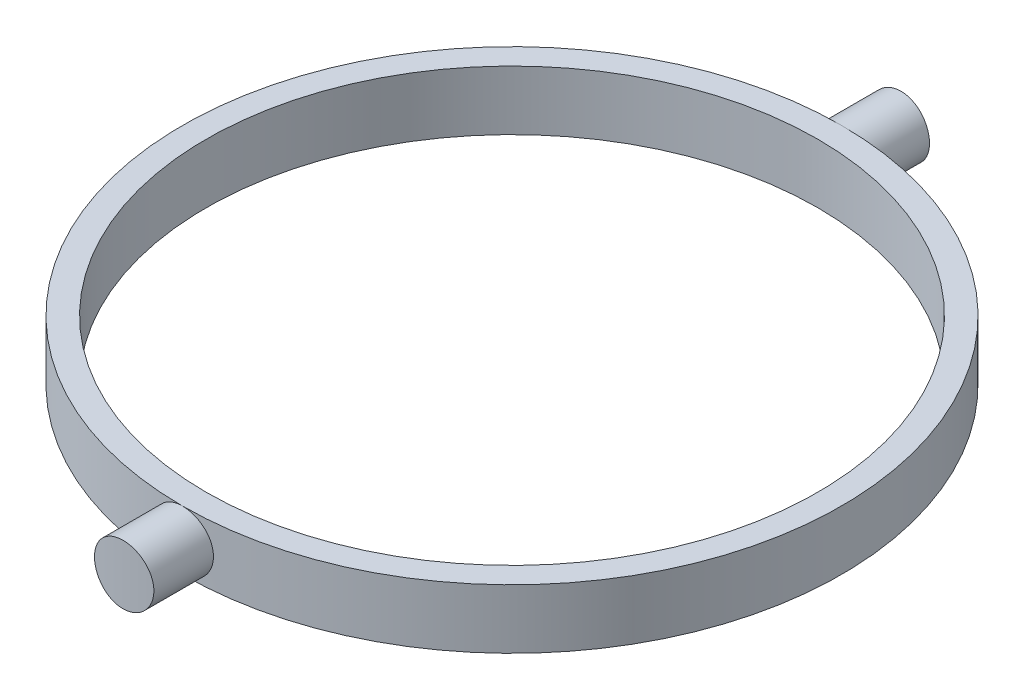
from build123d import *

# Parameters (mm, degrees)
SKETCH1_R               = 27.75
SKETCH1_R_2             = 25.75
BOSS_EXTRUDE1_DEPTH     = 2.5
BOSS_EXTRUDE2_START     = -32.750000066
BOSS_EXTRUDE2_OUTLINE_R = 2.5
BOSS_EXTRUDE2_DEPTH     = 65.500000132
BOSS_EXTRUDE2_START_2   = -3
BOSS_EXTRUDE2_2_DEPTH   = 6
CUT_EXTRUDE1_DEPTH      = 43.998546635
CUT_EXTRUDE1_DEPTH_BACK = 43.998546635
SKETCH3_R               = 25.75


with BuildPart() as part:
    # Sketch1 → Boss-Extrude1 (new, symmetric)
    with BuildSketch(Plane(origin=(0, 0, 0), x_dir=(1, 0, 0), z_dir=(0, 1, 0))):
        with Locations(Location((0, 0, 0), (0, 0, 270))):
            Circle(SKETCH1_R)
        with Locations(Location((0, 0, 0), (0, 0, 270))):
            Circle(SKETCH1_R_2, mode=Mode.SUBTRACT)
    extrude(amount=BOSS_EXTRUDE1_DEPTH, both=True)

    # Boss-Extrude2: read off the stored shape, not the designer's step
    # Boss-Extrude2 outline → Boss-Extrude2 (add)
    with BuildSketch(Plane.XY.offset(BOSS_EXTRUDE2_START)):
        Circle(BOSS_EXTRUDE2_OUTLINE_R)
    extrude(amount=BOSS_EXTRUDE2_DEPTH)

    # Boss-Extrude2 2 outline → Boss-Extrude2 2 (cut)
    with BuildSketch(Plane(origin=(0, 0, 0), x_dir=(1, 0, 0), z_dir=(0, 1, 0)).offset(BOSS_EXTRUDE2_START_2)):
        with BuildLine():
            Line((4, -32.539570024), (2.500688791, -32.654387999))
            ThreePointArc((2.500688791, -32.654387999), (1.251258189, -32.726088262), (4.28e-07, -32.75))
            Line((4.28e-07, -32.75), (4, -32.750000066))
            Line((4, -32.750000066), (4, -32.539570024))
        make_face()
        with BuildLine():
            Line((-4, -32.750000066), (4.28e-07, -32.75))
            ThreePointArc((4.28e-07, -32.75), (-1.250913366, -32.726101444), (-2.500001508, -32.654440624))
            Line((-2.500001508, -32.654440624), (-4, -32.539601772))
            Line((-4, -32.539601772), (-4, -32.750000066))
        make_face()
        with BuildLine():
            Line((2.500001316, 32.654440639), (4, 32.539601781))
            Line((4, 32.539601781), (4, 32.750000066))
            Line((4, 32.750000066), (1e-09, 32.75))
            ThreePointArc((1e-09, 32.75), (1.250913484, 32.72610144), (2.500001316, 32.654440639))
        make_face()
        with BuildLine():
            Line((-4, 32.750000066), (-4, 32.539577528))
            Line((-4, 32.539577528), (-2.500526303, 32.654400442))
            ThreePointArc((-2.500526303, 32.654400442), (-1.251176552, 32.726091384), (1e-09, 32.75))
            Line((1e-09, 32.75), (-4, 32.750000066))
        make_face()
    extrude(amount=BOSS_EXTRUDE2_2_DEPTH, mode=Mode.SUBTRACT)

    # Sketch3 → Cut-Extrude1 (cut, two sides: drawn at the far end of the back side and taken through both)
    with BuildSketch(Plane(origin=(0, 0, 0), x_dir=(1, 0, 0), z_dir=(0, 1, 0)).offset(-CUT_EXTRUDE1_DEPTH_BACK)):
        with Locations(Location((0, 0, 0), (0, 0, 270))):
            Circle(SKETCH3_R)
    extrude(amount=CUT_EXTRUDE1_DEPTH + CUT_EXTRUDE1_DEPTH_BACK, mode=Mode.SUBTRACT)


solid = part.part
